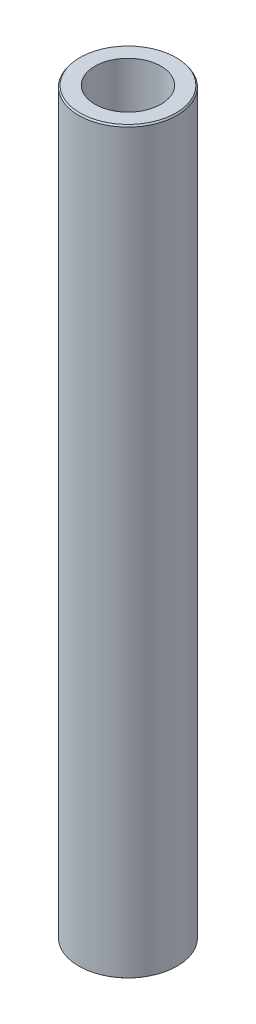
from build123d import *
from OCP.BRepFilletAPI import BRepFilletAPI_MakeChamfer

# Parameters (mm, degrees)
SKETCH1_R           = 15
BOSS_EXTRUDE1_DEPTH = 225.434529884
SKETCH2_R           = 10.065885065
CUT_EXTRUDE1_DEPTH  = 227.430402694
CHAMFER1_SIZE       = 0.466654149
CHAMFER1_SIZE2      = 0.355404783


with BuildPart() as part:
    # Sketch1 → Boss-Extrude1 (new body)
    with BuildSketch(Plane(origin=(0, 0, 0), x_dir=(1, 0, 0), z_dir=(0, 1, 0))):
        Circle(SKETCH1_R)
    extrude(amount=BOSS_EXTRUDE1_DEPTH)

    # Sketch2 → Cut-Extrude1 (cut, through all)
    with BuildSketch(Plane(origin=(0, 0, 0), x_dir=(1, 0, 0), z_dir=(0, 1, 0))):
        Circle(SKETCH2_R)
    extrude(amount=CUT_EXTRUDE1_DEPTH, mode=Mode.SUBTRACT)

    # Chamfer1: one chamfer whose edges measure the first distance from different faces: ONE call of the kernel's chamfer builder (chamfer() names one face for all edges)
    chamfer1_edges_1 = [part.edges().sort_by_distance(p)[0] for p in [
        (-15, 225.434529884, 0),
    ]]
    chamfer1_side_1 = [part.faces().sort_by_distance(p)[0] for p in [
        (-15, 112.717264942, 0),
    ]]
    chamfer1_edges_2 = [part.edges().sort_by_distance(p)[0] for p in [
        (-15, 0, 0),
    ]]
    chamfer1_side_2 = [part.faces().sort_by_distance(p)[0] for p in [
        (-14.575735931, 0, 0),
    ]]
    chamfer1 = BRepFilletAPI_MakeChamfer(part.part.solid().wrapped)
    for e in chamfer1_edges_1:
        chamfer1.Add(CHAMFER1_SIZE, CHAMFER1_SIZE2, e.wrapped, chamfer1_side_1[0].wrapped)  # the first distance lies on this face
    for e in chamfer1_edges_2:
        chamfer1.Add(CHAMFER1_SIZE, CHAMFER1_SIZE2, e.wrapped, chamfer1_side_2[0].wrapped)  # the first distance lies on this face
    add(Compound.cast(chamfer1.Shape()), mode=Mode.REPLACE)


solid = part.part
